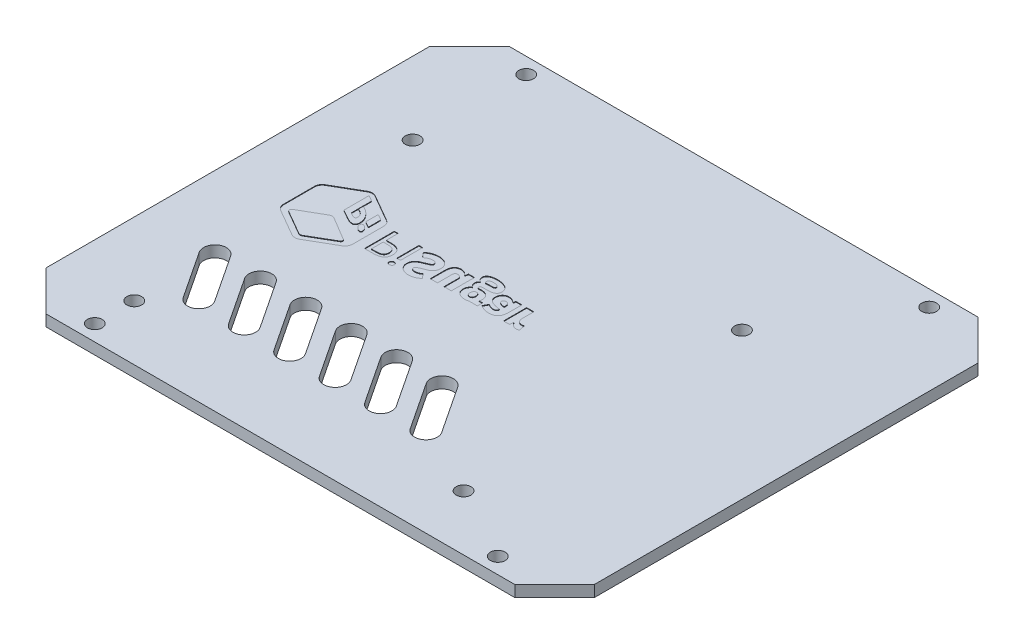
from build123d import *

# Parameters (mm, degrees)
EXTRUDE_1_DEPTH     = 2
CUT_EXTRUDE_1_REACH = 72.175
SKETCH_2_R          = 1.3
CUT_EXTRUDE_2_REACH = 72.175
SKETCH_3_R          = 1.3
CUT_EXTRUDE_3_REACH = 72.175
SKETCH_6_W          = 0.652006356
SKETCH_6_H          = 3.893311592
CUT_EXTRUDE_5_DEPTH = 0.1


with BuildPart() as part:
    # 草图1 → 凸台-拉伸1 (new body)
    with BuildSketch(Plane.XZ.offset(19.39)):
        Polygon((-51.8, -40.295836944), (-44.795836944, -47.3), (37.795836944, -47.3), (44.8, -40.295836944), (44.8, 27.295836944), (37.795836944, 34.3), (-44.795836944, 34.3), (-51.8, 27.295836944), align=None)
    extrude(amount=EXTRUDE_1_DEPTH)

    # 草图2 → 切除-拉伸1 (cut, up to next)
    with BuildSketch(Plane.XZ.offset(21.39), mode=Mode.PRIVATE) as cut_extrude_1_sk1:
        with Locations((-39.011567772, -24.5)):
            Circle(SKETCH_2_R)
    cut_extrude_1_tool1 = extrude(cut_extrude_1_sk1.sketch, amount=-CUT_EXTRUDE_1_REACH, mode=Mode.PRIVATE) & part.part
    # 草图2 → 切除-拉伸1 (cut, up to next)
    with BuildSketch(Plane.XZ.offset(21.39), mode=Mode.PRIVATE) as cut_extrude_1_sk2:
        with Locations((19, -24.5)):
            Circle(SKETCH_2_R)
    cut_extrude_1_tool2 = extrude(cut_extrude_1_sk2.sketch, amount=-CUT_EXTRUDE_1_REACH, mode=Mode.PRIVATE) & part.part
    # 草图2 → 切除-拉伸1 (cut, up to next)
    with BuildSketch(Plane.XZ.offset(21.39), mode=Mode.PRIVATE) as cut_extrude_1_sk3:
        with Locations((-39.011567772, 24.535212594)):
            Circle(SKETCH_2_R)
    cut_extrude_1_tool3 = extrude(cut_extrude_1_sk3.sketch, amount=-CUT_EXTRUDE_1_REACH, mode=Mode.PRIVATE) & part.part
    # 草图2 → 切除-拉伸1 (cut, up to next)
    with BuildSketch(Plane.XZ.offset(21.39), mode=Mode.PRIVATE) as cut_extrude_1_sk4:
        with Locations((19, 24.535212594)):
            Circle(SKETCH_2_R)
    cut_extrude_1_tool4 = extrude(cut_extrude_1_sk4.sketch, amount=-CUT_EXTRUDE_1_REACH, mode=Mode.PRIVATE) & part.part
    add(cut_extrude_1_tool1.solids().sort_by_distance((-39.011568, -21.39, -24.5))[0], mode=Mode.SUBTRACT)
    add(cut_extrude_1_tool2.solids().sort_by_distance((19, -21.39, -24.5))[0], mode=Mode.SUBTRACT)
    add(cut_extrude_1_tool3.solids().sort_by_distance((-39.011568, -21.39, 24.535213))[0], mode=Mode.SUBTRACT)
    add(cut_extrude_1_tool4.solids().sort_by_distance((19, -21.39, 24.535213))[0], mode=Mode.SUBTRACT)

    # 草图3 → 切除-拉伸2 (cut, up to next)
    with BuildSketch(Plane.XZ.offset(21.39), mode=Mode.PRIVATE) as cut_extrude_2_sk1:
        with Locations((32, -44.5)):
            Circle(SKETCH_3_R)
    cut_extrude_2_tool1 = extrude(cut_extrude_2_sk1.sketch, amount=-CUT_EXTRUDE_2_REACH, mode=Mode.PRIVATE) & part.part
    # 草图3 → 切除-拉伸2 (cut, up to next)
    with BuildSketch(Plane.XZ.offset(21.39), mode=Mode.PRIVATE) as cut_extrude_2_sk2:
        with Locations((-39, -44.5)):
            Circle(SKETCH_3_R)
    cut_extrude_2_tool2 = extrude(cut_extrude_2_sk2.sketch, amount=-CUT_EXTRUDE_2_REACH, mode=Mode.PRIVATE) & part.part
    # 草图3 → 切除-拉伸2 (cut, up to next)
    with BuildSketch(Plane.XZ.offset(21.39), mode=Mode.PRIVATE) as cut_extrude_2_sk3:
        with Locations((32, 31.5)):
            Circle(SKETCH_3_R)
    cut_extrude_2_tool3 = extrude(cut_extrude_2_sk3.sketch, amount=-CUT_EXTRUDE_2_REACH, mode=Mode.PRIVATE) & part.part
    # 草图3 → 切除-拉伸2 (cut, up to next)
    with BuildSketch(Plane.XZ.offset(21.39), mode=Mode.PRIVATE) as cut_extrude_2_sk4:
        with Locations((-39, 31.5)):
            Circle(SKETCH_3_R)
    cut_extrude_2_tool4 = extrude(cut_extrude_2_sk4.sketch, amount=-CUT_EXTRUDE_2_REACH, mode=Mode.PRIVATE) & part.part
    add(cut_extrude_2_tool1.solids().sort_by_distance((32, -21.39, -44.5))[0], mode=Mode.SUBTRACT)
    add(cut_extrude_2_tool2.solids().sort_by_distance((-39, -21.39, -44.5))[0], mode=Mode.SUBTRACT)
    add(cut_extrude_2_tool3.solids().sort_by_distance((32, -21.39, 31.5))[0], mode=Mode.SUBTRACT)
    add(cut_extrude_2_tool4.solids().sort_by_distance((-39, -21.39, 31.5))[0], mode=Mode.SUBTRACT)

    # 草图4 → 切除-拉伸3 (cut, up to next)
    with BuildSketch(Plane.XZ.offset(21.39), mode=Mode.PRIVATE) as cut_extrude_3_sk1:
        with BuildLine():
            Line((-40.69671065, 11.402772719), (-35.182847057, 19.74527284))
            ThreePointArc((-35.182847057, 19.74527284), (-32.411574314, 20.311000146), (-31.845847008, 17.539727403))
            Line((-31.845847008, 17.539727403), (-37.359710601, 9.197227281))
            ThreePointArc((-37.359710601, 9.197227281), (-40.130983344, 8.631499976), (-40.69671065, 11.402772719))
        make_face()
    cut_extrude_3_tool1 = extrude(cut_extrude_3_sk1.sketch, amount=-CUT_EXTRUDE_3_REACH, mode=Mode.PRIVATE) & part.part
    # 草图4 → 切除-拉伸3 (cut, up to next)
    with BuildSketch(Plane.XZ.offset(21.39), mode=Mode.PRIVATE) as cut_extrude_3_sk2:
        with BuildLine():
            Line((-32.69671065, 11.402772719), (-27.182847057, 19.74527284))
            ThreePointArc((-27.182847057, 19.74527284), (-24.411574314, 20.311000146), (-23.845847008, 17.539727403))
            Line((-23.845847008, 17.539727403), (-29.359710601, 9.197227281))
            ThreePointArc((-29.359710601, 9.197227281), (-32.130983344, 8.631499976), (-32.69671065, 11.402772719))
        make_face()
    cut_extrude_3_tool2 = extrude(cut_extrude_3_sk2.sketch, amount=-CUT_EXTRUDE_3_REACH, mode=Mode.PRIVATE) & part.part
    # 草图4 → 切除-拉伸3 (cut, up to next)
    with BuildSketch(Plane.XZ.offset(21.39), mode=Mode.PRIVATE) as cut_extrude_3_sk3:
        with BuildLine():
            Line((-24.69671065, 11.402772719), (-19.182847057, 19.74527284))
            ThreePointArc((-19.182847057, 19.74527284), (-16.411574314, 20.311000146), (-15.845847008, 17.539727403))
            Line((-15.845847008, 17.539727403), (-21.359710601, 9.197227281))
            ThreePointArc((-21.359710601, 9.197227281), (-24.130983344, 8.631499976), (-24.69671065, 11.402772719))
        make_face()
    cut_extrude_3_tool3 = extrude(cut_extrude_3_sk3.sketch, amount=-CUT_EXTRUDE_3_REACH, mode=Mode.PRIVATE) & part.part
    # 草图4 → 切除-拉伸3 (cut, up to next)
    with BuildSketch(Plane.XZ.offset(21.39), mode=Mode.PRIVATE) as cut_extrude_3_sk4:
        with BuildLine():
            Line((-16.69671065, 11.402772719), (-11.182847057, 19.74527284))
            ThreePointArc((-11.182847057, 19.74527284), (-8.411574314, 20.311000146), (-7.845847008, 17.539727403))
            Line((-7.845847008, 17.539727403), (-13.359710601, 9.197227281))
            ThreePointArc((-13.359710601, 9.197227281), (-16.130983344, 8.631499976), (-16.69671065, 11.402772719))
        make_face()
    cut_extrude_3_tool4 = extrude(cut_extrude_3_sk4.sketch, amount=-CUT_EXTRUDE_3_REACH, mode=Mode.PRIVATE) & part.part
    # 草图4 → 切除-拉伸3 (cut, up to next)
    with BuildSketch(Plane.XZ.offset(21.39), mode=Mode.PRIVATE) as cut_extrude_3_sk5:
        with BuildLine():
            Line((-8.69671065, 11.402772719), (-3.182847057, 19.74527284))
            ThreePointArc((-3.182847057, 19.74527284), (-0.411574314, 20.311000146), (0.154152992, 17.539727403))
            Line((0.154152992, 17.539727403), (-5.359710601, 9.197227281))
            ThreePointArc((-5.359710601, 9.197227281), (-8.130983344, 8.631499976), (-8.69671065, 11.402772719))
        make_face()
    cut_extrude_3_tool5 = extrude(cut_extrude_3_sk5.sketch, amount=-CUT_EXTRUDE_3_REACH, mode=Mode.PRIVATE) & part.part
    # 草图4 → 切除-拉伸3 (cut, up to next)
    with BuildSketch(Plane.XZ.offset(21.39), mode=Mode.PRIVATE) as cut_extrude_3_sk6:
        with BuildLine():
            Line((-0.69671065, 11.402772719), (4.817152943, 19.74527284))
            ThreePointArc((4.817152943, 19.74527284), (7.588425686, 20.311000146), (8.154152992, 17.539727403))
            Line((8.154152992, 17.539727403), (2.640289399, 9.197227281))
            ThreePointArc((2.640289399, 9.197227281), (-0.130983344, 8.631499976), (-0.69671065, 11.402772719))
        make_face()
    cut_extrude_3_tool6 = extrude(cut_extrude_3_sk6.sketch, amount=-CUT_EXTRUDE_3_REACH, mode=Mode.PRIVATE) & part.part
    add(cut_extrude_3_tool1.solids().sort_by_distance((-36.271279, -21.39, 14.47125))[0], mode=Mode.SUBTRACT)
    add(cut_extrude_3_tool2.solids().sort_by_distance((-28.271279, -21.39, 14.47125))[0], mode=Mode.SUBTRACT)
    add(cut_extrude_3_tool3.solids().sort_by_distance((-20.271279, -21.39, 14.47125))[0], mode=Mode.SUBTRACT)
    add(cut_extrude_3_tool4.solids().sort_by_distance((-12.271279, -21.39, 14.47125))[0], mode=Mode.SUBTRACT)
    add(cut_extrude_3_tool5.solids().sort_by_distance((-4.271279, -21.39, 14.47125))[0], mode=Mode.SUBTRACT)
    add(cut_extrude_3_tool6.solids().sort_by_distance((3.728721, -21.39, 14.47125))[0], mode=Mode.SUBTRACT)

    # 草图6 → 切除-拉伸5 (cut)
    # profile 1 of 9: a face of its own
    with BuildSketch(Plane(origin=(0, -19.39, 0), x_dir=(1, 0, 0), z_dir=(0, 1, 0))):
        with BuildLine():
            Line((-17.960896294, 5.947363387), (-18.626481477, 5.682937969))
            add(Edge.make_bspline(
                [(-18.626481477, 5.682937969), (-19.096064067, 5.496006478), (-19.433420036, 5.382033363), (-19.433420036, 5.08571996)],
                knots=[1, 1, 1, 1, 2, 2, 2, 2], degree=3))
            add(Edge.make_bspline(
                [(-19.433420036, 5.08571996), (-19.433420036, 4.80306886), (-19.191783676, 4.643489804), (-18.795159461, 4.643489804)],
                knots=[2, 2, 2, 2, 3, 3, 3, 3], degree=3))
            add(Edge.make_bspline(
                [(-18.795159461, 4.643489804), (-18.380337391, 4.643489804), (-18.052052525, 4.784815354), (-17.701062078, 5.053804148)],
                knots=[3, 3, 3, 3, 4, 4, 4, 4], degree=3))
            Line((-17.701062078, 5.053804148), (-17.062745852, 4.251428966))
            add(Edge.make_bspline(
                [(-17.062745852, 4.251428966), (-17.527765066, 3.781874202), (-18.17971577, 3.544801218), (-18.795159461, 3.544801218)],
                knots=[5, 5, 5, 5, 6, 6, 6, 6], degree=3))
            add(Edge.make_bspline(
                [(-18.795159461, 3.544801218), (-19.930327235, 3.544801218), (-20.732702417, 4.265119096), (-20.732702417, 5.15865051)],
                knots=[6, 6, 6, 6, 7, 7, 7, 7], degree=3))
            add(Edge.make_bspline(
                [(-20.732702417, 5.15865051), (-20.732702417, 5.933673257), (-20.208470608, 6.398692471), (-19.647676136, 6.622075324)],
                knots=[7, 7, 7, 7, 8, 8, 8, 8], degree=3))
            Line((-19.647676136, 6.622075324), (-18.968400822, 6.9092898))
            add(Edge.make_bspline(
                [(-18.968400822, 6.9092898), (-18.512508362, 7.100756842), (-18.216167133, 7.201067653), (-18.216167133, 7.511071187)],
                knots=[9, 9, 9, 9, 10, 10, 10, 10], degree=3))
            add(Edge.make_bspline(
                [(-18.216167133, 7.511071187), (-18.216167133, 7.798285662), (-18.439549986, 7.976062575), (-18.913695953, 7.976062575)],
                knots=[10, 10, 10, 10, 11, 11, 11, 11], degree=3))
            add(Edge.make_bspline(
                [(-18.913695953, 7.976062575), (-19.3330814, 7.976062575), (-19.83004425, 7.752679721), (-20.208470608, 7.429013883)],
                knots=[11, 11, 11, 11, 12, 12, 12, 12], degree=3))
            Line((-20.208470608, 7.429013883), (-20.933268387, 8.313446368))
            add(Edge.make_bspline(
                [(-20.933268387, 8.313446368), (-20.381656318, 8.819480321), (-19.634041657, 9.079342362), (-18.941076213, 9.079342362)],
                knots=[13, 13, 13, 13, 14, 14, 14, 14], degree=3))
            add(Edge.make_bspline(
                [(-18.941076213, 9.079342362), (-17.650864934, 9.079342362), (-16.903250273, 8.299756238), (-16.903250273, 7.410760376)],
                knots=[14, 14, 14, 14, 15, 15, 15, 15], degree=3))
            add(Edge.make_bspline(
                [(-16.903250273, 7.410760376), (-16.903250273, 6.658554512), (-17.299818836, 6.21176098), (-17.960896294, 5.947363387)],
                knots=[15, 15, 15, 15, 16, 16, 16, 16], degree=3))
        make_face()
    # profile 2 of 9: a face of its own
    with BuildSketch(Plane(origin=(0, -19.39, 0), x_dir=(1, 0, 0), z_dir=(0, 1, 0))):
        with BuildLine():
            Line((-26.709501542, 3.727169333), (-26.709501542, 8.979031552))
            Line((-26.709501542, 8.979031552), (-26.043860708, 8.979031552))
            Line((-26.043860708, 8.979031552), (-26.043860708, 6.89559967))
            Line((-26.043860708, 6.89559967), (-25.173090527, 6.89559967))
            add(Edge.make_bspline(
                [(-25.173090527, 6.89559967), (-24.028795999, 6.89559967), (-23.240110948, 6.375903413), (-23.240110948, 5.268060248)],
                knots=[5, 5, 5, 5, 6, 6, 6, 6], degree=3))
            add(Edge.make_bspline(
                [(-23.240110948, 5.268060248), (-23.240110948, 4.11923017), (-24.028795999, 3.727169333), (-25.20959754, 3.727169333)],
                knots=[6, 6, 6, 6, 7, 7, 7, 7], degree=3))
            Line((-25.20959754, 3.727169333), (-26.709501542, 3.727169333))
        make_face()
        with BuildLine():
            Line((-26.043860708, 6.357649906), (-26.043860708, 4.265119096))
            Line((-26.043860708, 4.265119096), (-25.287063642, 4.265119096))
            add(Edge.make_bspline(
                [(-25.287063642, 4.265119096), (-24.366151968, 4.265119096), (-23.901132754, 4.506727631), (-23.901132754, 5.268060248)],
                knots=[3, 3, 3, 3, 4, 4, 4, 4], degree=3))
            add(Edge.make_bspline(
                [(-23.901132754, 5.268060248), (-23.901132754, 6.020293938), (-24.334263982, 6.357649906), (-25.259683381, 6.357649906)],
                knots=[4, 4, 4, 4, 5, 5, 5, 5], degree=3))
            Line((-25.259683381, 6.357649906), (-26.043860708, 6.357649906))
        make_face(mode=Mode.SUBTRACT)
    # profile 3 of 9: a face of its own
    with BuildSketch(Plane(origin=(0, -19.39, 0), x_dir=(1, 0, 0), z_dir=(0, 1, 0))):
        with BuildLine():
            Line((-33.155771956, -0.188959143), (-33.812230386, -0.571921053))
            add(Edge.make_bspline(
                [(-33.812230386, -0.571921053), (-34.026542137, -0.690429719), (-34.263559469, -0.754261342), (-34.500632453, -0.754261342)],
                knots=[3, 3, 3, 3, 4, 4, 4, 4], degree=3))
            add(Edge.make_bspline(
                [(-34.500632453, -0.754261342), (-34.737705436, -0.754261342), (-34.974778419, -0.690429719), (-35.189034519, -0.571921053)],
                knots=[4, 4, 4, 4, 5, 5, 5, 5], degree=3))
            Line((-35.189034519, -0.571921053), (-35.8455486, -0.188959143))
            Line((-35.8455486, -0.188959143), (-39.251051921, 1.775936247))
            Line((-39.251051921, 1.775936247), (-39.907566003, 2.15433478))
            add(Edge.make_bspline(
                [(-39.907566003, 2.15433478), (-40.331514826, 2.400506691), (-40.595968069, 2.856399151), (-40.595968069, 3.344207423)],
                knots=[8, 8, 8, 8, 9, 9, 9, 9], degree=3))
            Line((-40.595968069, 3.344207423), (-40.595968069, 8.796691263))
            add(Edge.make_bspline(
                [(-40.595968069, 8.796691263), (-40.595968069, 9.289035086), (-40.331514826, 9.740391995), (-39.907566003, 9.986563906)],
                knots=[10, 10, 10, 10, 11, 11, 11, 11], degree=3))
            Line((-39.907566003, 9.986563906), (-39.251051921, 10.364962439))
            Line((-39.251051921, 10.364962439), (-35.8455486, 12.329857829))
            Line((-35.8455486, 12.329857829), (-35.189034519, 12.712791913))
            add(Edge.make_bspline(
                [(-35.189034519, 12.712791913), (-34.974778419, 12.835891782), (-34.737705436, 12.895160028), (-34.500632453, 12.895160028)],
                knots=[14, 14, 14, 14, 15, 15, 15, 15], degree=3))
            add(Edge.make_bspline(
                [(-34.500632453, 12.895160028), (-34.263559469, 12.895160028), (-34.026542137, 12.835891782), (-33.812230386, 12.712791913)],
                knots=[15, 15, 15, 15, 16, 16, 16, 16], degree=3))
            Line((-33.812230386, 12.712791913), (-33.155771956, 12.329857829))
            Line((-33.155771956, 12.329857829), (-29.750268635, 10.364962439))
            Line((-29.750268635, 10.364962439), (-29.093810204, 9.986563906))
            add(Edge.make_bspline(
                [(-29.093810204, 9.986563906), (-28.665242353, 9.740391995), (-28.405408138, 9.289035086), (-28.405408138, 8.796691263)],
                knots=[19, 19, 19, 19, 20, 20, 20, 20], degree=3))
            Line((-28.405408138, 8.796691263), (-28.405408138, 3.344207423))
            add(Edge.make_bspline(
                [(-28.405408138, 3.344207423), (-28.405408138, 2.856399151), (-28.665242353, 2.400506691), (-29.093810204, 2.15433478)],
                knots=[21, 21, 21, 21, 22, 22, 22, 22], degree=3))
            Line((-29.093810204, 2.15433478), (-29.750268635, 1.775936247))
            Line((-29.750268635, 1.775936247), (-33.155771956, -0.188959143))
        make_face()
        with BuildLine():
            Line((-39.032232445, 2.696847921), (-34.819790565, 0.26236994))
            add(Edge.make_bspline(
                [(-34.819790565, 0.26236994), (-34.623732321, 0.148396825), (-34.377532584, 0.148396825), (-34.176966614, 0.26236994)],
                knots=[3, 3, 3, 3, 4, 4, 4, 4], degree=3))
            Line((-34.176966614, 0.26236994), (-29.987341618, 2.701411297))
            add(Edge.make_bspline(
                [(-29.987341618, 2.701411297), (-29.773085518, 2.82448334), (-29.768522141, 3.134486874), (-29.982778241, 3.262150119)],
                knots=[5, 5, 5, 5, 6, 6, 6, 6], degree=3))
            Line((-29.982778241, 3.262150119), (-34.053866746, 5.696600274))
            add(Edge.make_bspline(
                [(-34.053866746, 5.696600274), (-34.327446743, 5.85617933), (-34.669366088, 5.85617933), (-34.942890434, 5.696600274)],
                knots=[7, 7, 7, 7, 8, 8, 8, 8], degree=3))
            add(Edge.make_bspline(
                [(-34.942890434, 5.696600274), (-39.064120431, 3.316854988), (-39.073247184, 3.312291612)],
                knots=[0, 0, 0, 1, 1, 1], degree=2))
            add(Edge.make_bspline(
                [(-39.073247184, 3.312291612), (-39.287503284, 3.157303757), (-39.264742051, 2.829046717), (-39.032232445, 2.696847921)],
                knots=[1, 1, 1, 1, 2, 2, 2, 2], degree=3))
        make_face(mode=Mode.SUBTRACT)
        with BuildLine():
            Line((-29.668239156, 9.539798199), (-30.543517063, 10.036705398))
            add(Edge.make_bspline(
                [(-30.543517063, 10.036705398), (-30.602785309, 10.06862121), (-30.675743685, 10.027578645), (-30.675743685, 9.959211471)],
                knots=[2, 2, 2, 2, 3, 3, 3, 3], degree=3))
            Line((-30.675743685, 9.959211471), (-30.675743685, 7.94871014))
            add(Edge.make_bspline(
                [(-30.675743685, 7.94871014), (-30.675743685, 7.916822154), (-30.657490178, 7.889441894), (-30.630109918, 7.871216213)],
                knots=[4, 4, 4, 4, 5, 5, 5, 5], degree=3))
            Line((-30.630109918, 7.871216213), (-29.754832011, 7.378844565))
            add(Edge.make_bspline(
                [(-29.754832011, 7.378844565), (-29.695563765, 7.346956579), (-29.622605389, 7.387971318), (-29.622605389, 7.456366317)],
                knots=[6, 6, 6, 6, 7, 7, 7, 7], degree=3))
            Line((-29.622605389, 7.456366317), (-29.622605389, 9.462276447))
            add(Edge.make_bspline(
                [(-29.622605389, 9.462276447), (-29.622605389, 9.494192258), (-29.640858896, 9.526108069), (-29.668239156, 9.539798199)],
                knots=[0, 0, 0, 0, 1, 1, 1, 1], degree=3))
        make_face(mode=Mode.SUBTRACT)
        with BuildLine():
            Line((-33.310815461, 9.124920478), (-33.310815461, 8.04902095))
            add(Edge.make_bspline(
                [(-33.310815461, 8.04902095), (-33.310815461, 8.017105139), (-33.292561954, 7.985189328), (-33.265181694, 7.971527023)],
                knots=[4, 4, 4, 4, 5, 5, 5, 5], degree=3))
            Line((-33.265181694, 7.971527023), (-32.873120856, 7.752679721))
            add(Edge.make_bspline(
                [(-32.873120856, 7.752679721), (-32.362523527, 7.460929694), (-32.079872428, 7.456366317), (-32.079872428, 7.903132024)],
                knots=[6, 6, 6, 6, 7, 7, 7, 7], degree=3))
            add(Edge.make_bspline(
                [(-32.079872428, 7.903132024), (-32.079872428, 8.336235426), (-32.326016514, 8.719169511), (-32.845796247, 9.010947363)],
                knots=[0, 0, 0, 0, 1, 1, 1, 1], degree=3))
            Line((-32.845796247, 9.010947363), (-33.265181694, 9.220667912))
            Line((-33.265181694, 9.220667912), (-33.265181694, 10.086846891))
            Line((-33.265181694, 10.086846891), (-32.791035727, 9.822449298))
            add(Edge.make_bspline(
                [(-31.040479913, 7.315040768), (-31.040479913, 8.368151238), (-31.856489574, 9.293598462), (-32.791035727, 9.822449298)],
                knots=[10, 10, 10, 10, 11, 11, 11, 11], degree=3))
            add(Edge.make_bspline(
                [(-32.822979364, 6.881937366), (-31.847362821, 6.330297472), (-31.040479913, 6.220887733), (-31.040479913, 7.315040768)],
                knots=[9, 9, 9, 9, 10, 10, 10, 10], degree=3))
            Line((-32.822979364, 6.881937366), (-34.327446743, 7.73445404))
            add(Edge.make_bspline(
                [(-34.373024858, 7.811947967), (-34.373024858, 7.780032156), (-34.359334728, 7.748116344), (-34.327446743, 7.73445404)],
                knots=[7, 7, 7, 7, 8, 8, 8, 8], degree=3))
            Line((-34.373024858, 7.811947967), (-34.373024858, 12.0335166))
            add(Edge.make_bspline(
                [(-34.240798237, 12.111010527), (-34.300066483, 12.142926338), (-34.373024858, 12.101911599), (-34.373024858, 12.0335166)],
                knots=[5, 5, 5, 5, 6, 6, 6, 6], degree=3))
            Line((-34.240798237, 12.111010527), (-33.356337926, 11.609539951))
            add(Edge.make_bspline(
                [(-33.310815461, 11.532046024), (-33.310815461, 11.563961835), (-33.32444994, 11.59131427), (-33.356337926, 11.609539951)],
                knots=[3, 3, 3, 3, 4, 4, 4, 4], degree=3))
            Line((-33.310815461, 11.532046024), (-33.310815461, 10.164368644))
            Line((-33.310815461, 10.164368644), (-33.310815461, 9.124920478))
        make_face(mode=Mode.SUBTRACT)
        with BuildLine():
            add(Edge.make_bspline(
                [(-30.146892849, 6.043082996), (-29.79584675, 5.8424892), (-29.545139288, 5.929109881), (-29.545139288, 6.248240168), (-29.545139288, 6.562807078), (-29.79584675, 6.932078858), (-30.146892849, 7.128109277)],
                knots=[2, 2, 2, 2, 3, 3, 3, 4, 4, 4, 4], degree=3))
            add(Edge.make_bspline(
                [(-30.146892849, 7.128109277), (-30.502446673, 7.333266449), (-30.753209786, 7.246645769), (-30.753209786, 6.932078858), (-30.753209786, 6.608385194), (-30.502446673, 6.243676791), (-30.146892849, 6.043082996)],
                knots=[0, 0, 0, 0, 1, 1, 1, 2, 2, 2, 2], degree=3))
        make_face(mode=Mode.SUBTRACT)
    # profile 4 of 9: a face of its own
    with BuildSketch(Plane(origin=(0, -19.39, 0), x_dir=(1, 0, 0), z_dir=(0, 1, 0))):
        with BuildLine():
            Line((-5.373712147, 8.568745033), (-5.282555916, 8.979031552))
            Line((-5.282555916, 8.979031552), (-4.24310775, 8.979031552))
            Line((-4.24310775, 8.979031552), (-4.24310775, 6.663117889))
            add(Edge.make_bspline(
                [(-4.24310775, 6.663117889), (-4.24310775, 5.38659674), (-4.840297935, 4.80306886), (-5.893380579, 4.80306886)],
                knots=[11, 11, 11, 11, 12, 12, 12, 12], degree=3))
            add(Edge.make_bspline(
                [(-5.893380579, 4.80306886), (-6.527133428, 4.80306886), (-7.110633482, 5.01732496), (-7.648611071, 5.336455248)],
                knots=[0, 0, 0, 0, 1, 1, 1, 1], degree=3))
            Line((-7.648611071, 5.336455248), (-7.201845365, 6.175309617))
            add(Edge.make_bspline(
                [(-7.201845365, 6.175309617), (-6.796038746, 5.947363387), (-6.458682778, 5.819700142), (-6.135016939, 5.819700142)],
                knots=[2, 2, 2, 2, 3, 3, 3, 3], degree=3))
            add(Edge.make_bspline(
                [(-6.135016939, 5.819700142), (-5.720194869, 5.819700142), (-5.546897857, 6.011167184), (-5.519573248, 6.339424225)],
                knots=[3, 3, 3, 3, 4, 4, 4, 4], degree=3))
            add(Edge.make_bspline(
                [(-5.519573248, 6.339424225), (-7.110633482, 6.512665586), (-7.78540107, 6.977656974), (-7.78540107, 7.839300402)],
                knots=[4, 4, 4, 4, 5, 5, 5, 5], degree=3))
            add(Edge.make_bspline(
                [(-7.78540107, 7.839300402), (-7.78540107, 8.518575715), (-7.324945233, 9.079342362), (-6.572655893, 9.079342362)],
                knots=[5, 5, 5, 5, 6, 6, 6, 6], degree=3))
            add(Edge.make_bspline(
                [(-6.572655893, 9.079342362), (-6.121326809, 9.079342362), (-5.742956102, 8.869621814), (-5.405600133, 8.568745033)],
                knots=[6, 6, 6, 6, 7, 7, 7, 7], degree=3))
            Line((-5.405600133, 8.568745033), (-5.373712147, 8.568745033))
        make_face()
        with BuildLine():
            Line((-5.519573248, 7.114446972), (-5.519573248, 7.766369851))
            add(Edge.make_bspline(
                [(-5.519573248, 7.766369851), (-5.706504739, 7.966963647), (-5.875182723, 8.09003569), (-6.135016939, 8.09003569)],
                knots=[0, 0, 0, 0, 1, 1, 1, 1], degree=3))
            add(Edge.make_bspline(
                [(-6.135016939, 8.09003569), (-6.399470183, 8.09003569), (-6.572655893, 7.976062575), (-6.572655893, 7.739017417)],
                knots=[1, 1, 1, 1, 2, 2, 2, 2], degree=3))
            add(Edge.make_bspline(
                [(-6.572655893, 7.739017417), (-6.572655893, 7.451802941), (-6.312821677, 7.223856711), (-5.519573248, 7.114446972)],
                knots=[2, 2, 2, 2, 3, 3, 3, 3], degree=3))
        make_face(mode=Mode.SUBTRACT)
    # profile 5 of 9: a face of its own
    with BuildSketch(Plane(origin=(0, -19.39, 0), x_dir=(1, 0, 0), z_dir=(0, 1, 0))):
        with BuildLine():
            Line((-8.0133473, 5.824263519), (-8.0133473, 4.903351845))
            Line((-8.0133473, 4.903351845), (-9.508632274, 4.903351845))
            add(Edge.make_bspline(
                [(-9.508632274, 4.903351845), (-9.695563765, 4.834984672), (-9.918946619, 4.80306886), (-10.156019602, 4.80306886)],
                knots=[9, 9, 9, 9, 10, 10, 10, 10], degree=3))
            add(Edge.make_bspline(
                [(-10.156019602, 4.80306886), (-11.035860886, 4.80306886), (-11.861052951, 5.286313755), (-11.861052951, 6.284719356)],
                knots=[10, 10, 10, 10, 11, 11, 11, 11], degree=3))
            add(Edge.make_bspline(
                [(-11.861052951, 6.284719356), (-11.861052951, 6.758837497), (-11.596599708, 7.13723603), (-11.309440883, 7.337829826)],
                knots=[11, 11, 11, 11, 12, 12, 12, 12], degree=3))
            Line((-11.309440883, 7.337829826), (-11.309440883, 7.36518226))
            add(Edge.make_bspline(
                [(-11.309440883, 7.36518226), (-11.573838475, 7.552085926), (-11.760769966, 7.839300402), (-11.760769966, 8.126514878)],
                knots=[13, 13, 13, 13, 14, 14, 14, 14], degree=3))
            add(Edge.make_bspline(
                [(-11.760769966, 8.126514878), (-11.760769966, 8.468434223), (-11.601163084, 8.682718148), (-11.386906984, 8.828607074)],
                knots=[14, 14, 14, 14, 15, 15, 15, 15], degree=3))
            Line((-11.386906984, 8.828607074), (-11.386906984, 8.865058437))
            add(Edge.make_bspline(
                [(-11.386906984, 8.865058437), (-11.765333343, 9.056553304), (-11.965899313, 9.33007765), (-11.965899313, 9.667433619)],
                knots=[16, 16, 16, 16, 17, 17, 17, 17], degree=3))
            add(Edge.make_bspline(
                [(-11.965899313, 9.667433619), (-11.965899313, 10.396850425), (-11.195467767, 10.693191654), (-10.256302587, 10.693191654)],
                knots=[17, 17, 17, 17, 18, 18, 18, 18], degree=3))
            add(Edge.make_bspline(
                [(-10.256302587, 10.693191654), (-8.838483714, 10.693191654), (-7.949460026, 10.08231134), (-7.949460026, 9.220667912)],
                knots=[18, 18, 18, 18, 19, 19, 19, 19], degree=3))
            add(Edge.make_bspline(
                [(-7.949460026, 9.220667912), (-7.949460026, 8.482124353), (-8.514762225, 8.17665637), (-9.517759028, 8.17665637)],
                knots=[19, 19, 19, 19, 20, 20, 20, 20], degree=3))
            Line((-9.517759028, 8.17665637), (-10.160582979, 8.17665637))
            add(Edge.make_bspline(
                [(-10.160582979, 8.17665637), (-10.598221932, 8.17665637), (-10.76233654, 8.09003569), (-10.76233654, 7.903132024)],
                knots=[1, 1, 1, 1, 2, 2, 2, 2], degree=3))
            add(Edge.make_bspline(
                [(-10.76233654, 7.903132024), (-10.76233654, 7.766369851), (-10.730448554, 7.702538229), (-10.634728946, 7.615917548)],
                knots=[2, 2, 2, 2, 3, 3, 3, 3], degree=3))
            add(Edge.make_bspline(
                [(-10.634728946, 7.615917548), (-10.456868557, 7.666059041), (-10.292809601, 7.688875924), (-10.156019602, 7.688875924)],
                knots=[3, 3, 3, 3, 4, 4, 4, 4], degree=3))
            add(Edge.make_bspline(
                [(-10.156019602, 7.688875924), (-9.253361435, 7.688875924), (-8.528452355, 7.273998203), (-8.528452355, 6.321198544)],
                knots=[4, 4, 4, 4, 5, 5, 5, 5], degree=3))
            add(Edge.make_bspline(
                [(-8.528452355, 6.321198544), (-8.528452355, 6.125140299), (-8.578649498, 5.938236634), (-8.64242547, 5.824263519)],
                knots=[5, 5, 5, 5, 6, 6, 6, 6], degree=3))
            Line((-8.64242547, 5.824263519), (-8.0133473, 5.824263519))
        make_face()
        with BuildLine():
            Line((-10.146892849, 9.152272913), (-9.759339737, 9.152272913))
            add(Edge.make_bspline(
                [(-9.759339737, 9.152272913), (-9.38102468, 9.152272913), (-9.166712929, 9.202414405), (-9.166712929, 9.444050765)],
                knots=[4, 4, 4, 4, 5, 5, 5, 5], degree=3))
            add(Edge.make_bspline(
                [(-9.166712929, 9.444050765), (-9.166712929, 9.703912807), (-9.531393507, 9.895379849), (-10.055736617, 9.895379849)],
                knots=[5, 5, 5, 5, 6, 6, 6, 6], degree=3))
            add(Edge.make_bspline(
                [(-10.055736617, 9.895379849), (-10.579968426, 9.895379849), (-10.921887771, 9.754054299), (-10.921887771, 9.466839823)],
                knots=[0, 0, 0, 0, 1, 1, 1, 1], degree=3))
            add(Edge.make_bspline(
                [(-10.921887771, 9.466839823), (-10.921887771, 9.33007765), (-10.858111799, 9.216104535), (-10.730448554, 9.10213142)],
                knots=[1, 1, 1, 1, 2, 2, 2, 2], degree=3))
            add(Edge.make_bspline(
                [(-10.730448554, 9.10213142), (-10.598221932, 9.138610608), (-10.443178427, 9.152272913), (-10.146892849, 9.152272913)],
                knots=[2, 2, 2, 2, 3, 3, 3, 3], degree=3))
        make_face(mode=Mode.SUBTRACT)
        with BuildLine():
            add(Edge.make_bspline(
                [(-10.156019602, 6.922952105), (-10.447741804, 6.922952105), (-10.671124657, 6.708696005), (-10.671124657, 6.284719356), (-10.671124657, 5.869841635), (-10.447741804, 5.655585535), (-10.156019602, 5.655585535)],
                knots=[2, 2, 2, 2, 3, 3, 3, 4, 4, 4, 4], degree=3))
            add(Edge.make_bspline(
                [(-10.156019602, 5.655585535), (-9.855114996, 5.655585535), (-9.640858896, 5.869841635), (-9.640858896, 6.284719356), (-9.640858896, 6.708696005), (-9.855114996, 6.922952105), (-10.156019602, 6.922952105)],
                knots=[0, 0, 0, 0, 1, 1, 1, 2, 2, 2, 2], degree=3))
        make_face(mode=Mode.SUBTRACT)
    # profile 6 of 9: a face of its own
    with BuildSketch(Plane(origin=(0, -19.39, 0), x_dir=(1, 0, 0), z_dir=(0, 1, 0))):
        with BuildLine():
            Line((-13.876062008, 4.903351845), (-13.876062008, 7.574902809))
            add(Edge.make_bspline(
                [(-13.876062008, 7.574902809), (-14.090318108, 7.87577959), (-14.268178497, 7.989752705), (-14.555337322, 7.989752705)],
                knots=[1, 1, 1, 1, 2, 2, 2, 2], degree=3))
            add(Edge.make_bspline(
                [(-14.555337322, 7.989752705), (-14.879058811, 7.989752705), (-15.029483289, 7.830201474), (-15.029483289, 7.26487145)],
                knots=[2, 2, 2, 2, 3, 3, 3, 3], degree=3))
            Line((-15.029483289, 7.26487145), (-15.029483289, 4.903351845))
            Line((-15.029483289, 4.903351845), (-16.301441061, 4.903351845))
            Line((-16.301441061, 4.903351845), (-16.301441061, 7.424450506))
            add(Edge.make_bspline(
                [(-16.301441061, 7.424450506), (-16.301441061, 8.441081788), (-15.923014702, 9.079342362), (-15.034046665, 9.079342362)],
                knots=[6, 6, 6, 6, 7, 7, 7, 7], degree=3))
            add(Edge.make_bspline(
                [(-15.034046665, 9.079342362), (-14.47787122, 9.079342362), (-14.094881485, 8.819480321), (-13.757525516, 8.41829273)],
                knots=[7, 7, 7, 7, 8, 8, 8, 8], degree=3))
            Line((-13.757525516, 8.41829273), (-13.730200907, 8.41829273))
            Line((-13.730200907, 8.41829273), (-13.638989025, 8.979031552))
            Line((-13.638989025, 8.979031552), (-12.59959651, 8.979031552))
            Line((-12.59959651, 8.979031552), (-12.59959651, 4.903351845))
            Line((-12.59959651, 4.903351845), (-13.876062008, 4.903351845))
        make_face()
    # profile 7 of 9: a face of its own
    with BuildSketch(Plane(origin=(0, -19.39, 0), x_dir=(1, 0, 0), z_dir=(0, 1, 0))):
        with Locations((-22.052519993, 7.032375756)):
            Rectangle(SKETCH_6_W, SKETCH_6_H)
    # profile 8 of 9: a face of its own
    with BuildSketch(Plane(origin=(0, -19.39, 0), x_dir=(1, 0, 0), z_dir=(0, 1, 0))):
        with BuildLine():
            Line((-3.404225555, 8.979031552), (-2.13683116, 8.979031552))
            Line((-2.13683116, 8.979031552), (-2.13683116, 6.649427759))
            add(Edge.make_bspline(
                [(-2.13683116, 6.649427759), (-1.92257506, 6.111477995), (-1.557838831, 5.920010953), (-1.256989876, 5.920010953)],
                knots=[7, 7, 7, 7, 8, 8, 8, 8], degree=3))
            add(Edge.make_bspline(
                [(-1.256989876, 5.920010953), (-1.074621762, 5.920010953), (-0.95608527, 5.947363387), (-0.810224169, 5.98381475)],
                knots=[8, 8, 8, 8, 9, 9, 9, 9], degree=3))
            Line((-0.810224169, 5.98381475), (-0.595968069, 4.885126164))
            add(Edge.make_bspline(
                [(-0.595968069, 4.885126164), (-0.709941184, 4.834984672), (-0.846675532, 4.80306886), (-1.088311892, 4.80306886)],
                knots=[10, 10, 10, 10, 11, 11, 11, 11], degree=3))
            add(Edge.make_bspline(
                [(-1.088311892, 4.80306886), (-1.498626236, 4.80306886), (-1.94995532, 5.067494278), (-2.250804275, 5.609979593)],
                knots=[0, 0, 0, 0, 1, 1, 1, 1], degree=3))
            Line((-2.250804275, 5.609979593), (-2.278184535, 5.609979593))
            Line((-2.278184535, 5.609979593), (-2.36477739, 4.903351845))
            Line((-2.36477739, 4.903351845), (-3.404225555, 4.903351845))
            Line((-3.404225555, 4.903351845), (-3.404225555, 8.979031552))
        make_face()
    # profile 9 of 9: a face of its own
    with BuildSketch(Plane(origin=(0, -19.39, 0), x_dir=(1, 0, 0), z_dir=(0, 1, 0))):
        with BuildLine():
            add(Edge.make_bspline(
                [(-22.050238305, 4.283344778), (-21.790404089, 4.283344778), (-21.598909221, 4.10554004), (-21.598909221, 3.863931505), (-21.598909221, 3.594942711), (-21.790404089, 3.439954857), (-22.050238305, 3.439954857)],
                knots=[2, 2, 2, 2, 3, 3, 3, 4, 4, 4, 4], degree=3))
            add(Edge.make_bspline(
                [(-22.050238305, 3.439954857), (-22.310072521, 3.439954857), (-22.501567388, 3.594942711), (-22.501567388, 3.863931505), (-22.501567388, 4.10554004), (-22.310072521, 4.283344778), (-22.050238305, 4.283344778)],
                knots=[0, 0, 0, 0, 1, 1, 1, 2, 2, 2, 2], degree=3))
        make_face()
    extrude(amount=-CUT_EXTRUDE_5_DEPTH, mode=Mode.SUBTRACT)


solid = part.part
